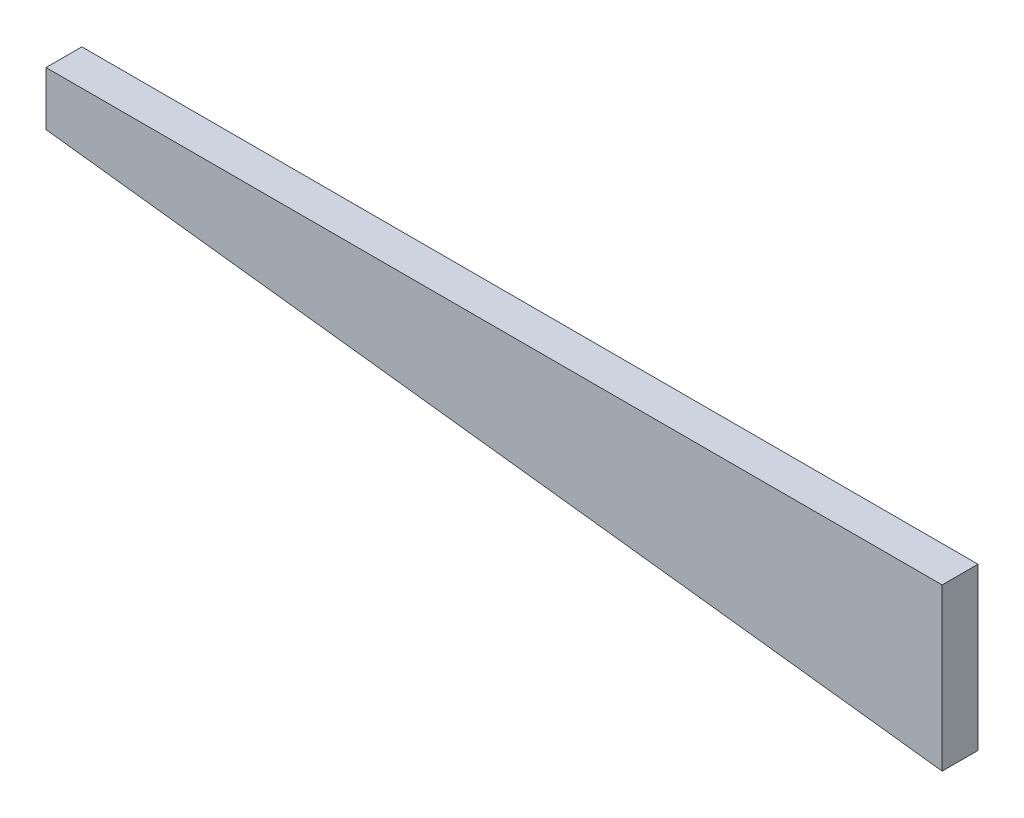
from build123d import *

# Parameters (mm, degrees)
BASE_FLANGE1_DEPTH = 50.8


# Sheet-metal steps are written as plain solids
with BuildPart() as part:
    # Sketch1 → Base-Flange1 (new body)
    with BuildSketch(Plane.XY):
        Polygon((-81.344303797, 14.539803094), (-1351.344303797, 14.539803094), (-1351.344303797, -61.660196906), (-81.344303797, -214.060196906), align=None)
    extrude(amount=BASE_FLANGE1_DEPTH)


solid = part.part
